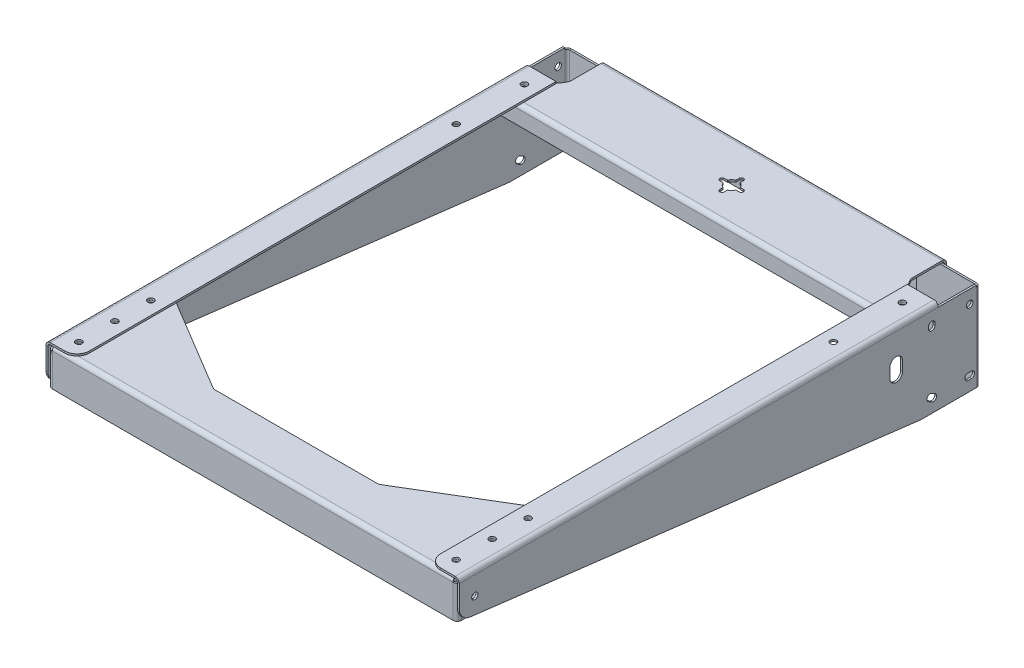
from build123d import *

# Parameters (mm, degrees)
SKETCH4_R                    = 2.6
BASE_FLANGE1_DEPTH           = 1.51892
EDGE_FLANGE1_STRIP_W         = 9.88568
EDGE_FLANGE1_STRIP_H         = 1.51892
EDGE_FLANGE1_STRIP_CUT_DEPTH = 75
EDGE_FLANGE1_DEPTH           = 75
EDGE_FLANGE2_DEPTH           = 420
EDGE_FLANGE2_2_DEPTH         = 3.42392
EDGE_FLANGE2_START           = 3.42392
EDGE_FLANGE2_3_DEPTH         = 416.57608
CUT_EXTRUDE6_START           = -46.57608
SKETCH32_W                   = 3.42392
SKETCH32_H                   = 5.01892
CUT_EXTRUDE6_DEPTH           = 50
FILLET2_R                    = 10
SKETCH17_R                   = 2.5
BASE_FLANGE2_DEPTH           = 1.51892
EDGE_FLANGE3_STRIP_W         = 9.93568
EDGE_FLANGE3_STRIP_H         = 1.51892
EDGE_FLANGE3_STRIP_CUT_DEPTH = 275.03784
EDGE_FLANGE3_DEPTH           = 275.03784
CUT_EXTRUDE7_DEPTH           = 1.51892
SKETCH29_W                   = 25
SKETCH29_H                   = 30.57608
CUT_EXTRUDE2_DEPTH           = 3.42392
SKETCH30_R                   = 2.5
BOSS_EXTRUDE1_DEPTH          = 1.51892
EDGE_FLANGE5_STRIP_W         = 9.88568
EDGE_FLANGE5_STRIP_H         = 1.51892
EDGE_FLANGE5_STRIP_CUT_DEPTH = 326.19
EDGE_FLANGE5_DEPTH           = 326.19
SKETCH17_2_R                 = 2.5
CUT_EXTRUDE4_DEPTH           = 1.56892
SKETCH30_2_R                 = 2.5
CUT_EXTRUDE5_DEPTH           = 1.51892
FILLET3_R                    = 5
SKETCH37_R                   = 2.5
BASE_FLANGE3_DEPTH           = 1.51892
EDGE_FLANGE6_STRIP_W         = 9.88568
EDGE_FLANGE6_STRIP_H         = 1.51892
EDGE_FLANGE6_STRIP_CUT_DEPTH = 325
EDGE_FLANGE6_DEPTH           = 325
EDGE_FLANGE7_START           = -4.99284
EDGE_FLANGE7_OUTLINE_W       = 1.02392
EDGE_FLANGE7_OUTLINE_H       = 3.42392
EDGE_FLANGE7_DEPTH           = 3.42392
EDGE_FLANGE7_START_2         = -31.56892
EDGE_FLANGE7_2_DEPTH         = 26.57608
EDGE_FLANGE7_3_DEPTH         = 26.57608
FILLET4_R                    = 5
SKETCH37_2_R                 = 2.5
CUT_EXTRUDE8_DEPTH           = 1.56892
CUT_EXTRUDE9_START           = -333.03784
SKETCH49_R                   = 2.5
CUT_EXTRUDE9_DEPTH           = 333.03784
SKETCH50_R                   = 2.5
CUT_EXTRUDE10_DEPTH          = 1.51892
CUT_EXTRUDE11_DEPTH          = 1.51892


# Read off the part's stored shape, not the designer's step: Edge-Flange2, Edge-Flange7
# Sheet-metal steps are written as plain solids
with BuildPart() as part:
    # Sketch4 → Base-Flange1 (new body)
    with BuildSketch(Plane(origin=(-165, 0, 0), x_dir=(0, 0, -1), z_dir=(1, 0, 0))):
        Polygon((0, 0), (0, -75), (-48, -75), (-420, -30), (-420, 0), align=None)
        with Locations((-8.75, -14)):
            Circle(SKETCH4_R, mode=Mode.SUBTRACT)
        with BuildLine():
            ThreePointArc((-41.838657457, -13.133543011), (-41.85, -14), (-41.838657457, -14.866456989))
            ThreePointArc((-41.838657457, -14.866456989), (-39.171488346, -17.397505968), (-36.640439367, -14.730336858))
            ThreePointArc((-36.640439367, -14.730336858), (-36.65, -14), (-36.640439367, -13.269663142))
            ThreePointArc((-36.640439367, -13.269663142), (-39.171488346, -10.602494032), (-41.838657457, -13.133543011))
        make_face(mode=Mode.SUBTRACT)
        with BuildLine():
            ThreePointArc((-39.136782751, -61.001043457), (-42.731821696, -61.772856249), (-41.960008903, -65.367895194))
            ThreePointArc((-41.960008903, -65.367895194), (-40.603973925, -66.219629386), (-39.226107825, -67.035574852))
            ThreePointArc((-39.226107825, -67.035574852), (-35.676389317, -66.076670001), (-36.635294168, -62.526951493))
            ThreePointArc((-36.635294168, -62.526951493), (-37.896026075, -61.780370614), (-39.136782751, -61.001043457))
        make_face(mode=Mode.SUBTRACT)
        with BuildLine():
            ThreePointArc((-7.373092519, -66.581975294), (-4.84204354, -63.914806183), (-7.50921265, -61.383757204))
            ThreePointArc((-7.50921265, -61.383757204), (-8.75, -61.4), (-9.99078735, -61.383757204))
            ThreePointArc((-9.99078735, -61.383757204), (-12.65795646, -63.914806183), (-10.126907481, -66.581975294))
            ThreePointArc((-10.126907481, -66.581975294), (-8.75, -66.6), (-7.373092519, -66.581975294))
        make_face(mode=Mode.SUBTRACT)
    extrude(amount=-BASE_FLANGE1_DEPTH)

    # Edge-Flange1 strip (across the edge) → Edge-Flange1 strip cut (cut)
    with BuildSketch(Plane(origin=(-165, -75, 0), x_dir=(0, 0, 1), z_dir=(0, 1, 0))):
        with Locations((-1.51892, -0.75946)):
            Rectangle(EDGE_FLANGE1_STRIP_W, EDGE_FLANGE1_STRIP_H)
    extrude(amount=EDGE_FLANGE1_STRIP_CUT_DEPTH, mode=Mode.SUBTRACT)

    # Edge-Flange1 section (across the edge) → Edge-Flange1 (add)
    with BuildSketch(Plane(origin=(-165, -75, 0), x_dir=(0, 0, 1), z_dir=(0, 1, 0))):
        with BuildLine():
            Line((0, 1.905), (0, 48.48108))
            Line((0, 48.48108), (1.51892, 48.48108))
            Line((1.51892, 48.48108), (1.51892, 1.905))
            ThreePointArc((1.51892, 1.905), (2.076881582, 0.557961582), (3.42392, 0))
            Line((3.42392, 0), (3.42392, -1.51892))
            ThreePointArc((3.42392, -1.51892), (1.00284295, -0.51607705), (0, 1.905))
        make_face()
    extrude(amount=EDGE_FLANGE1_DEPTH)

    # Edge-Flange2 outline → Edge-Flange2 (cut)
    with BuildSketch(Plane.XY):
        with BuildLine():
            Line((-163.095, 0), (-166.51892, 0))
            Line((-166.51892, 0), (-166.51892, -3.42392))
            ThreePointArc((-166.51892, -3.42392), (-165.51607705, -1.00284295), (-163.095, 0))
        make_face()
        with BuildLine():
            Line((-163.095, -3.42392), (-163.095, -1.51892))
            ThreePointArc((-163.095, -1.51892), (-164.442038418, -2.076881582), (-165, -3.42392))
            Line((-165, -3.42392), (-163.095, -3.42392))
        make_face()
    extrude(amount=EDGE_FLANGE2_DEPTH, mode=Mode.SUBTRACT)

    # Edge-Flange2 2 outline → Edge-Flange2 2 (cut)
    with BuildSketch(Plane.XY):
        with BuildLine():
            Line((-163.095, -1.51892), (-163.095, 0))
            ThreePointArc((-163.095, 0), (-165.51607705, -1.00284295), (-166.51892, -3.42392))
            Line((-166.51892, -3.42392), (-165, -3.42392))
            ThreePointArc((-165, -3.42392), (-164.442038418, -2.076881582), (-163.095, -1.51892))
        make_face()
    extrude(amount=EDGE_FLANGE2_2_DEPTH, mode=Mode.SUBTRACT)

    # Edge-Flange2 3 outline → Edge-Flange2 3 (add)
    with BuildSketch(Plane.XY.offset(EDGE_FLANGE2_START)):
        with BuildLine():
            Line((-141.51892, 0), (-163.095, 0))
            ThreePointArc((-163.095, 0), (-164.090507046, -0.14791727), (-165, -0.578888688))
            Line((-165, -0.578888688), (-165, -3.42392))
            ThreePointArc((-165, -3.42392), (-164.442038418, -2.076881582), (-163.095, -1.51892))
            Line((-163.095, -1.51892), (-141.51892, -1.51892))
            Line((-141.51892, -1.51892), (-141.51892, 0))
        make_face()
    extrude(amount=EDGE_FLANGE2_3_DEPTH)

    # Sketch32 → Cut-Extrude6 (cut)
    with BuildSketch(Plane.ZY.offset(163.095).offset(CUT_EXTRUDE6_START)):
        with Locations((1.71196, -2.50946)):
            Rectangle(SKETCH32_W, SKETCH32_H)
    extrude(amount=CUT_EXTRUDE6_DEPTH, mode=Mode.SUBTRACT)

    # Fillet2
    fillet2_edges = [part.edges().sort_by_distance(p)[0] for p in [
        (-141.51892, -0.75946, 420),
        (-165.75946, -30, 420),
    ]]
    fillet(fillet2_edges, radius=FILLET2_R)


with BuildPart() as body_2:
    # Mirror1: mirrored copy
    add(part.part.mirror(Plane(origin=(0, 0, 0), x_dir=(0, 0, 1), z_dir=(1, 0, 0))))


with BuildPart() as body_3:
    # Sketch17 → Base-Flange2 (new body)
    with BuildSketch(Plane(origin=(0, 0, -0.05), x_dir=(-1, 0, 0), z_dir=(0, 0, -1))):
        Polygon((137.51892, -75), (115, -75), (75, -35), (-75, -35), (-115, -75), (-137.51892, -75), (-137.51892, -1.56892), (137.51892, -1.56892), align=None)
        with Locations((131.01892, -40.00946)):
            Circle(SKETCH17_R, mode=Mode.SUBTRACT)
        with Locations((123.01892, -10.00946)):
            Circle(SKETCH17_R, mode=Mode.SUBTRACT)
        with Locations((123.01892, -70.00946)):
            Circle(SKETCH17_R, mode=Mode.SUBTRACT)
        with Locations(Location((-123.01892, -70.00946, 0), (0, 0, 180))):
            Circle(SKETCH17_R, mode=Mode.SUBTRACT)
        with Locations(Location((-131.01892, -40.00946, 0), (0, 0, 180))):
            Circle(SKETCH17_R, mode=Mode.SUBTRACT)
        with Locations(Location((-123.01892, -10.00946, 0), (0, 0, 180))):
            Circle(SKETCH17_R, mode=Mode.SUBTRACT)
    extrude(amount=BASE_FLANGE2_DEPTH)

    # Edge-Flange3 strip (across the edge) → Edge-Flange3 strip cut (cut)
    with BuildSketch(Plane(origin=(137.51892, -1.51892, -0.05), x_dir=(0, -1, 0), z_dir=(-1, 0, 0))):
        with Locations((-1.54392, -0.75946)):
            Rectangle(EDGE_FLANGE3_STRIP_W, EDGE_FLANGE3_STRIP_H)
    extrude(amount=EDGE_FLANGE3_STRIP_CUT_DEPTH, mode=Mode.SUBTRACT)

    # Edge-Flange3 section (across the edge) → Edge-Flange3 (add)
    with BuildSketch(Plane(origin=(137.51892, -1.51892, -0.05), x_dir=(0, -1, 0), z_dir=(-1, 0, 0))):
        with BuildLine():
            Line((0, 1.905), (0, 63.48108))
            Line((0, 63.48108), (1.51892, 63.48108))
            Line((1.51892, 63.48108), (1.51892, 1.905))
            ThreePointArc((1.51892, 1.905), (2.076881582, 0.557961582), (3.42392, 0))
            Line((3.42392, 0), (3.42392, -1.51892))
            ThreePointArc((3.42392, -1.51892), (1.00284295, -0.51607705), (0, 1.905))
        make_face()
    extrude(amount=EDGE_FLANGE3_DEPTH)

    # Sketch36 → Cut-Extrude7 (cut)
    with BuildSketch(Plane(origin=(0, -1.51892, 0), x_dir=(1, 0, 0), z_dir=(0, 1, 0))):
        with BuildLine():
            Line((1.75, -41.75), (1.75, -39.082137838))
            ThreePointArc((1.75, -39.082137838), (3.800698949, -37.800698949), (5.082137838, -35.75))
            Line((5.082137838, -35.75), (7.75, -35.75))
            ThreePointArc((7.75, -35.75), (9.5, -34), (7.75, -32.25))
            Line((7.75, -32.25), (5.082137838, -32.25))
            ThreePointArc((5.082137838, -32.25), (3.800698949, -30.199301051), (1.75, -28.917862162))
            Line((1.75, -28.917862162), (1.75, -26.25))
            ThreePointArc((1.75, -26.25), (0, -24.5), (-1.75, -26.25))
            Line((-1.75, -26.25), (-1.75, -28.917862162))
            ThreePointArc((-1.75, -28.917862162), (-3.800698949, -30.199301051), (-5.082137838, -32.25))
            Line((-5.082137838, -32.25), (-7.75, -32.25))
            ThreePointArc((-7.75, -32.25), (-9.5, -34), (-7.75, -35.75))
            Line((-7.75, -35.75), (-5.082137838, -35.75))
            ThreePointArc((-5.082137838, -35.75), (-3.800698949, -37.800698949), (-1.75, -39.082137838))
            Line((-1.75, -39.082137838), (-1.75, -41.75))
            ThreePointArc((-1.75, -41.75), (0, -43.5), (1.75, -41.75))
        make_face()
    extrude(amount=-CUT_EXTRUDE7_DEPTH, mode=Mode.SUBTRACT)

    # Sketch30 → Boss-Extrude1 (add)
    # profile 1 of 2: a face of its own
    with BuildSketch(Plane(origin=(0, -1.51892, 0), x_dir=(1, 0, 0), z_dir=(0, 1, 0))):
        Polygon((-137.51892, -27.07179677), (-141.51892, -34), (-163.095, -34), (-163.095, -63.43108), (-137.51892, -63.43108), align=None)
        with Locations(Location((-152.30696, -48.71554, 0), (0, 0, 270))):
            Circle(SKETCH30_R, mode=Mode.SUBTRACT)
    # profile 2 of 2: a face of its own
    with BuildSketch(Plane(origin=(0, -1.51892, 0), x_dir=(1, 0, 0), z_dir=(0, 1, 0))):
        Polygon((137.51892, -27.07179677), (137.51892, -63.43108), (163.095, -63.43108), (163.095, -34), (141.51892, -34), align=None)
        with Locations(Location((152.30696, -48.71554, 0), (0, 0, 90))):
            Circle(SKETCH30_R, mode=Mode.SUBTRACT)
    extrude(amount=-BOSS_EXTRUDE1_DEPTH)

    # Edge-Flange5 strip (across the edge) → Edge-Flange5 strip cut (cut)
    with BuildSketch(Plane(origin=(163.095, -3.03784, 63.43108), x_dir=(0, 0, -1), z_dir=(-1, 0, 0))):
        with Locations((-1.51892, -0.75946)):
            Rectangle(EDGE_FLANGE5_STRIP_W, EDGE_FLANGE5_STRIP_H)
    extrude(amount=EDGE_FLANGE5_STRIP_CUT_DEPTH, mode=Mode.SUBTRACT)

    # Edge-Flange5 section (across the edge) → Edge-Flange5 (add)
    with BuildSketch(Plane(origin=(163.095, -3.03784, 63.43108), x_dir=(0, 0, -1), z_dir=(-1, 0, 0))):
        with BuildLine():
            Line((0, 1.905), (0, 13.48108))
            Line((0, 13.48108), (1.51892, 13.48108))
            Line((1.51892, 13.48108), (1.51892, 1.905))
            ThreePointArc((1.51892, 1.905), (2.076881582, 0.557961582), (3.42392, 0))
            Line((3.42392, 0), (3.42392, -1.51892))
            ThreePointArc((3.42392, -1.51892), (1.00284295, -0.51607705), (0, 1.905))
        make_face()
    extrude(amount=EDGE_FLANGE5_DEPTH)

    # Fillet3
    fillet3_edges = [body_3.edges().sort_by_distance(p)[0] for p in [
        (-137.51892, -2.27838, 27.07179677),
        (-163.095, -2.27838, 34),
        (-141.51892, -2.27838, 34),
        (-75, -35, -0.80946),
        (75, -35, -0.80946),
        (115, -75, -0.80946),
        (137.51892, -75, -0.80946),
        (-137.51892, -75, -0.80946),
        (-115, -75, -0.80946),
        (137.51892, -2.27838, 27.07179677),
        (141.51892, -2.27838, 34),
        (163.095, -2.27838, 34),
        (163.095, -16.51892, 62.67162),
        (-163.095, -16.51892, 62.67162),
    ]]
    fillet(fillet3_edges, radius=FILLET3_R)


with BuildPart() as cut_extrude2_tool:
    # Sketch29 → Cut-Extrude2 (new body)
    with BuildSketch(Plane(origin=(0, 0, 0), x_dir=(1, 0, 0), z_dir=(0, 1, 0))):
        with Locations((154.01892, -18.71196)):
            Rectangle(SKETCH29_W, SKETCH29_H)
        with Locations((-154.01892, -18.71196)):
            Rectangle(SKETCH29_W, SKETCH29_H)
    extrude(amount=-CUT_EXTRUDE2_DEPTH)


with BuildPart() as part_1:
    add(part.part)

    # Cut-Extrude2: cut by cut_extrude2_tool
    add(cut_extrude2_tool.part, mode=Mode.SUBTRACT)


with BuildPart() as body_2_1:
    add(body_2.part)

    # Cut-Extrude2: cut by cut_extrude2_tool
    add(cut_extrude2_tool.part, mode=Mode.SUBTRACT)


with BuildPart() as cut_extrude4_tool:
    # Sketch17<2> → Cut-Extrude4 (new body)
    with BuildSketch(Plane(origin=(0, 0, -0.05), x_dir=(-1, 0, 0), z_dir=(0, 0, -1))):
        with Locations((123.01892, -10.00946)):
            Circle(SKETCH17_2_R)
        with Locations((131.01892, -40.00946)):
            Circle(SKETCH17_2_R)
        with Locations((123.01892, -70.00946)):
            Circle(SKETCH17_2_R)
        with Locations(Location((-123.01892, -10.00946, 0), (0, 0, 180))):
            Circle(SKETCH17_2_R)
        with Locations(Location((-131.01892, -40.00946, 0), (0, 0, 180))):
            Circle(SKETCH17_2_R)
        with Locations(Location((-123.01892, -70.00946, 0), (0, 0, 180))):
            Circle(SKETCH17_2_R)
    extrude(amount=-CUT_EXTRUDE4_DEPTH)


with BuildPart() as part_2:
    add(part_1.part)

    # Cut-Extrude4: cut by cut_extrude4_tool
    add(cut_extrude4_tool.part, mode=Mode.SUBTRACT)


with BuildPart() as body_2_2:
    add(body_2_1.part)

    # Cut-Extrude4: cut by cut_extrude4_tool
    add(cut_extrude4_tool.part, mode=Mode.SUBTRACT)


with BuildPart() as cut_extrude5_tool:
    # Sketch30<2> → Cut-Extrude5 (new body)
    with BuildSketch(Plane(origin=(0, -1.51892, 0), x_dir=(1, 0, 0), z_dir=(0, 1, 0))):
        with Locations(Location((-152.30696, -48.71554, 0), (0, 0, 270))):
            Circle(SKETCH30_2_R)
        with Locations(Location((152.30696, -48.71554, 0), (0, 0, 90))):
            Circle(SKETCH30_2_R)
    extrude(amount=CUT_EXTRUDE5_DEPTH)


with BuildPart() as part_3:
    add(part_2.part)

    # Cut-Extrude5: cut by cut_extrude5_tool
    add(cut_extrude5_tool.part, mode=Mode.SUBTRACT)


with BuildPart() as body_2_3:
    add(body_2_2.part)

    # Cut-Extrude5: cut by cut_extrude5_tool
    add(cut_extrude5_tool.part, mode=Mode.SUBTRACT)


with BuildPart() as body_4:
    # Sketch37 → Base-Flange3 (new body)
    with BuildSketch(Plane(origin=(0, -1.56892, 0), x_dir=(-1, 0, 0), z_dir=(0, -1, 0))):
        Polygon((162.5, -420), (-162.5, -420), (-162.5, -340), (-141.51892, -340), (-66.51892, -385), (66.51892, -385), (141.51892, -340), (162.5, -340), align=None)
        with Locations(Location((152, -379, 0), (0, 0, 180))):
            Circle(SKETCH37_R, mode=Mode.SUBTRACT)
        with Locations(Location((152, -350, 0), (0, 0, 180))):
            Circle(SKETCH37_R, mode=Mode.SUBTRACT)
        with Locations((-152, -350)):
            Circle(SKETCH37_R, mode=Mode.SUBTRACT)
        with Locations((-152, -379)):
            Circle(SKETCH37_R, mode=Mode.SUBTRACT)
        with Locations(Location((152, -408, 0), (0, 0, 180))):
            Circle(SKETCH37_R, mode=Mode.SUBTRACT)
        with Locations((-152, -408)):
            Circle(SKETCH37_R, mode=Mode.SUBTRACT)
    extrude(amount=BASE_FLANGE3_DEPTH)

    # Edge-Flange6 strip (across the edge) → Edge-Flange6 strip cut (cut)
    with BuildSketch(Plane(origin=(162.5, -3.08784, 420), x_dir=(0, 0, -1), z_dir=(-1, 0, 0))):
        with Locations((-1.51892, -0.75946)):
            Rectangle(EDGE_FLANGE6_STRIP_W, EDGE_FLANGE6_STRIP_H)
    extrude(amount=EDGE_FLANGE6_STRIP_CUT_DEPTH, mode=Mode.SUBTRACT)

    # Edge-Flange6 section (across the edge) → Edge-Flange6 (add)
    with BuildSketch(Plane(origin=(162.5, -3.08784, 420), x_dir=(0, 0, -1), z_dir=(-1, 0, 0))):
        with BuildLine():
            Line((0, 1.905), (0, 28.48108))
            Line((0, 28.48108), (1.51892, 28.48108))
            Line((1.51892, 28.48108), (1.51892, 1.905))
            ThreePointArc((1.51892, 1.905), (2.076881582, 0.557961582), (3.42392, 0))
            Line((3.42392, 0), (3.42392, -1.51892))
            ThreePointArc((3.42392, -1.51892), (1.00284295, -0.51607705), (0, 1.905))
        make_face()
    extrude(amount=EDGE_FLANGE6_DEPTH)

    # Edge-Flange7 outline → Edge-Flange7 (cut)
    with BuildSketch(Plane(origin=(0, 0, 0), x_dir=(1, 0, 0), z_dir=(0, 1, 0)).offset(EDGE_FLANGE7_START)):
        with Locations((161.98804, -418.28804)):
            Rectangle(EDGE_FLANGE7_OUTLINE_W, EDGE_FLANGE7_OUTLINE_H)
        with Locations((-161.98804, -418.28804)):
            Rectangle(EDGE_FLANGE7_OUTLINE_W, EDGE_FLANGE7_OUTLINE_H)
    extrude(amount=EDGE_FLANGE7_DEPTH, mode=Mode.SUBTRACT)

    # Edge-Flange7 2 outline → Edge-Flange7 2 (cut)
    with BuildSketch(Plane(origin=(0, 0, 0), x_dir=(1, 0, 0), z_dir=(0, 1, 0)).offset(EDGE_FLANGE7_START_2)):
        with BuildLine():
            ThreePointArc((162.5, -419.843313692), (161.99399958, -419.96060175), (161.47608, -420))
            Line((161.47608, -420), (162.5, -420))
            Line((162.5, -420), (162.5, -419.843313692))
        make_face()
        with BuildLine():
            Line((-162.5, -420), (-161.47608, -420))
            ThreePointArc((-161.47608, -420), (-161.99399958, -419.96060175), (-162.5, -419.843313692))
            Line((-162.5, -419.843313692), (-162.5, -420))
        make_face()
    extrude(amount=EDGE_FLANGE7_2_DEPTH, mode=Mode.SUBTRACT)

    # Edge-Flange7 3 outline → Edge-Flange7 3 (add)
    with BuildSketch(Plane(origin=(0, 0, 0), x_dir=(1, 0, 0), z_dir=(0, 1, 0)).offset(EDGE_FLANGE7_START_2)):
        with BuildLine():
            Line((161.47608, -418.48108), (162.5, -418.48108))
            Line((162.5, -418.48108), (162.5, -419.843313692))
            ThreePointArc((162.5, -419.843313692), (164.235522727, -418.603073833), (164.9, -416.57608))
            Line((164.9, -416.57608), (164.9, -395))
            Line((164.9, -395), (163.38108, -395))
            Line((163.38108, -395), (163.38108, -416.57608))
            ThreePointArc((163.38108, -416.57608), (162.823118418, -417.923118418), (161.47608, -418.48108))
        make_face()
        with BuildLine():
            Line((-162.5, -418.48108), (-161.47608, -418.48108))
            ThreePointArc((-161.47608, -418.48108), (-162.823118418, -417.923118418), (-163.38108, -416.57608))
            Line((-163.38108, -416.57608), (-163.38108, -395))
            Line((-163.38108, -395), (-164.9, -395))
            Line((-164.9, -395), (-164.9, -416.57608))
            ThreePointArc((-164.9, -416.57608), (-164.235522727, -418.603073833), (-162.5, -419.843313692))
            Line((-162.5, -419.843313692), (-162.5, -418.48108))
        make_face()
    extrude(amount=EDGE_FLANGE7_3_DEPTH)

    # Fillet4
    fillet4_edges = [body_4.edges().sort_by_distance(p)[0] for p in [
        (-164.14054, -31.56892, 395),
        (-164.14054, -4.99284, 395),
        (162.5, -2.32838, 340),
        (141.51892, -2.32838, 340),
        (66.51892, -2.32838, 385),
        (-66.51892, -2.32838, 385),
        (-141.51892, -2.32838, 340),
        (164.14054, -4.99284, 395),
        (-162.5, -2.32838, 340),
        (164.14054, -31.56892, 395),
    ]]
    fillet(fillet4_edges, radius=FILLET4_R)


with BuildPart() as cut_extrude8_tool:
    # Sketch37<2> → Cut-Extrude8 (new body)
    with BuildSketch(Plane(origin=(0, -1.56892, 0), x_dir=(-1, 0, 0), z_dir=(0, -1, 0))):
        with Locations(Location((152, -379, 0), (0, 0, 180))):
            Circle(SKETCH37_2_R)
        with Locations(Location((152, -350, 0), (0, 0, 180))):
            Circle(SKETCH37_2_R)
        with Locations((-152, -350)):
            Circle(SKETCH37_2_R)
        with Locations((-152, -379)):
            Circle(SKETCH37_2_R)
        with Locations(Location((152, -408, 0), (0, 0, 180))):
            Circle(SKETCH37_2_R)
        with Locations((-152, -408)):
            Circle(SKETCH37_2_R)
    extrude(amount=-CUT_EXTRUDE8_DEPTH)


with BuildPart() as part_4:
    add(part_3.part)

    # Cut-Extrude8: cut by cut_extrude8_tool
    add(cut_extrude8_tool.part, mode=Mode.SUBTRACT)


with BuildPart() as body_2_4:
    add(body_2_3.part)

    # Cut-Extrude8: cut by cut_extrude8_tool
    add(cut_extrude8_tool.part, mode=Mode.SUBTRACT)


with BuildPart() as cut_extrude9_tool:
    # Sketch49 → Cut-Extrude9 (new body)
    with BuildSketch(Plane.ZY.offset(166.51892).offset(CUT_EXTRUDE9_START)):
        with Locations(Location((407.5, -18.28088, 0), (0, 0, 270))):
            Circle(SKETCH49_R)
    extrude(amount=CUT_EXTRUDE9_DEPTH)


with BuildPart() as part_5:
    add(part_4.part)

    # Cut-Extrude9: cut by cut_extrude9_tool
    add(cut_extrude9_tool.part, mode=Mode.SUBTRACT)


with BuildPart() as body_2_5:
    add(body_2_4.part)

    # Cut-Extrude9: cut by cut_extrude9_tool
    add(cut_extrude9_tool.part, mode=Mode.SUBTRACT)


with BuildPart() as body_4_1:
    add(body_4.part)

    # Cut-Extrude9: cut by cut_extrude9_tool
    add(cut_extrude9_tool.part, mode=Mode.SUBTRACT)


with BuildPart() as cut_extrude10_tool:
    # Sketch50 → Cut-Extrude10 (new body)
    with BuildSketch(Plane(origin=(0, 0, 0), x_dir=(1, 0, 0), z_dir=(0, 1, 0))):
        with Locations(Location((-152, -104, 0), (0, 0, 180))):
            Circle(SKETCH50_R)
        with Locations(Location((152, -104, 0), (0, 0, 180))):
            Circle(SKETCH50_R)
    extrude(amount=-CUT_EXTRUDE10_DEPTH)


with BuildPart() as part_6:
    add(part_5.part)

    # Cut-Extrude10: cut by cut_extrude10_tool
    add(cut_extrude10_tool.part, mode=Mode.SUBTRACT)


with BuildPart() as body_2_6:
    add(body_2_5.part)

    # Cut-Extrude10: cut by cut_extrude10_tool
    add(cut_extrude10_tool.part, mode=Mode.SUBTRACT)

    # Sketch51 → Cut-Extrude11 (cut)
    with BuildSketch(Plane(origin=(166.51892, 0, 0), x_dir=(0, 0, -1), z_dir=(1, 0, 0))):
        with BuildLine():
            Line((-62.93108, -26), (-62.93108, -34))
            ThreePointArc((-62.93108, -34), (-67.93108, -39), (-72.93108, -34))
            Line((-72.93108, -34), (-72.93108, -26))
            ThreePointArc((-72.93108, -26), (-67.93108, -21), (-62.93108, -26))
        make_face()
    extrude(amount=-CUT_EXTRUDE11_DEPTH, mode=Mode.SUBTRACT)


solid = Compound([body_3.part, body_4_1.part, part_6.part, body_2_6.part])
